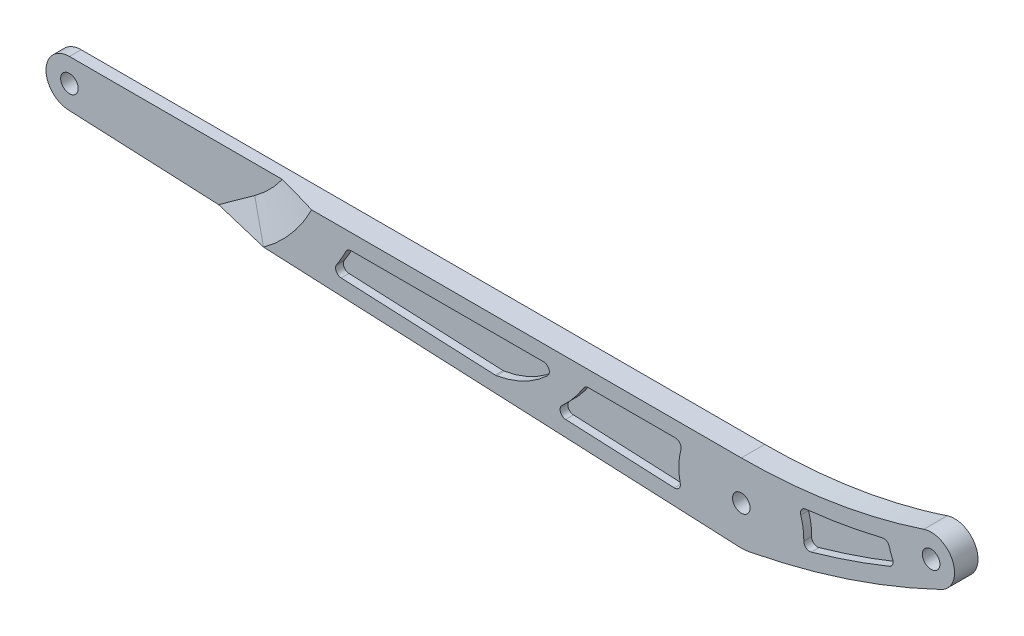
from build123d import *

# Parameters (mm, degrees)
BOSS_EXTRUDE2_DEPTH     = 4
CUT_EXTRUDE1_DEPTH      = 3
BOSS_EXTRUDE4_DEPTH     = 24
CUT_EXTRUDE3_DEPTH      = 25
CUT_EXTRUDE3_DEPTH_BACK = 183.067360447
SKETCH8_OUTSIDE_W       = 285.221
SKETCH8_OUTSIDE_H       = 85.963
CUT_EXTRUDE5_START      = -2
SKETCH15_R              = 6
CUT_EXTRUDE5_DEPTH      = 2
FILLET2_START           = -5
FILLET2_DEPTH           = 3
CUT_EXTRUDE4_DEPTH      = 2
FILLET1_R               = 1.5
FILLET1_OF_MIRROR2_R    = 1.5
CHAMFER2_SIZE           = 2
M4_CLEARANCE_HOLE1_D    = 4.5


with BuildPart() as part:
    # Sketch1 → Boss-Extrude2 (new, symmetric)
    with BuildSketch(Plane.XY):
        with BuildLine():
            Line((-174.954279742, 10), (0, 10))
            ThreePointArc((0, 10), (23.648322027, 11.894462409), (46.69345503, 17.529528282))
            ThreePointArc((46.69345503, 17.529528282), (54.142205969, 14.082195987), (51.181218931, 6.427096624))
            ThreePointArc((51.181218931, 6.427096624), (27.055536633, -3.305079876), (1.870729257, -9.823460289))
            ThreePointArc((1.870729257, -9.823460289), (0.711714534, -9.974640967), (-0.457023425, -9.98955102))
            Line((-0.457023425, -9.98955102), (-175.228493797, -1.993730612))
            ThreePointArc((-175.228493797, -1.993730612), (-180.95271219, 4.137142857), (-174.954279742, 10))
        make_face()
    extrude(amount=BOSS_EXTRUDE2_DEPTH, both=True)

    # Sketch4 → Cut-Extrude1 (cut)
    with BuildSketch(Plane.XY.offset(4)):
        with BuildLine():
            ThreePointArc((-174.954279742, 10), (-180.95271219, 4.137142857), (-175.228493797, -1.993730612))
            Line((-175.228493797, -1.993730612), (-122.27878396, -4.416187605))
            ThreePointArc((-122.27878396, -4.416187605), (-115.249733713, 2.05087413), (-109.954279742, 10))
            Line((-109.954279742, 10), (-174.954279742, 10))
        make_face()
    extrude(amount=-CUT_EXTRUDE1_DEPTH, mode=Mode.SUBTRACT)

    # Sweep2: sweep along a curve in space
    with BuildLine() as sweep2_path:
        ThreePointArc((-122.27878396, -4.416187605, 1), (-115.249733713, 2.05087413, 1), (-109.954279742, 10, 1))
    # Sketch9 → Sweep2 (sweep)
    with BuildSketch(Plane(origin=(-18.347220561, -36.300543819, 0), x_dir=(0.8924819376724606, -0.45108313083999296, 0), z_dir=(0.4510831308399929, 0.8924819376724605, 0))):
        Polygon((-102.643039948, -1), (-102.643039948, -4), (-111.643039948, -1), align=None)
    sweep(path=sweep2_path.line)

    # Sketch10 → Boss-Extrude4 (add)
    with BuildSketch(Plane(origin=(-82.616299838, -59.493723404, 0), x_dir=(0, 0, 1), z_dir=(-0.8114878209620178, -0.584369332212357, 0))):
        Polygon((1, 67.87228887), (4, 67.87228887), (1, 76.87228887), align=None)
    extrude(amount=BOSS_EXTRUDE4_DEPTH)

    # Sketch8 outside → Cut-Extrude3 (cut, two sides: drawn at the far end of the back side and taken through both)
    with BuildSketch(Plane.XY.offset(-4).offset(-CUT_EXTRUDE3_DEPTH_BACK)):
        with Locations((-63.1875, -0.3035)):
            Rectangle(SKETCH8_OUTSIDE_W, SKETCH8_OUTSIDE_H)
        with BuildLine():
            Line((0, 10), (-174.954279742, 10))
            ThreePointArc((-174.954279742, 10), (-180.95271219, 4.137142857), (-175.228493797, -1.993730612))
            Line((-175.228493797, -1.993730612), (-0.457023425, -9.98955102))
            ThreePointArc((-0.457023425, -9.98955102), (0.711714534, -9.974640967), (1.870729257, -9.823460289))
            ThreePointArc((1.870729257, -9.823460289), (27.055536633, -3.305079876), (51.181218931, 6.427096624))
            ThreePointArc((51.181218931, 6.427096624), (54.142205969, 14.082195987), (46.69345503, 17.529528282))
            ThreePointArc((46.69345503, 17.529528282), (23.648322027, 11.894462409), (0, 10))
        make_face(mode=Mode.SUBTRACT)
    extrude(amount=CUT_EXTRUDE3_DEPTH + CUT_EXTRUDE3_DEPTH_BACK, mode=Mode.SUBTRACT)

    # Sketch15 → Cut-Extrude5 (cut)
    with BuildSketch(Plane(origin=(0, 0, -4), x_dir=(-1, 0, 0), z_dir=(0, 0, -1)).offset(CUT_EXTRUDE5_START)):
        with Locations((-48.579466687, 11.83365609)):
            Circle(SKETCH15_R)
    extrude(amount=CUT_EXTRUDE5_DEPTH, mode=Mode.SUBTRACT)

    # Fillet2: read off the stored shape, not the designer's step
    # Fillet2 outline → Fillet2 (cut)
    with BuildSketch(Plane.XY.offset(FILLET2_START)):
        with BuildLine():
            ThreePointArc((40.241823664, 15.554681857), (42.163553049, 15.077161786), (42.732589809, 13.180515689))
            ThreePointArc((42.732589809, 13.180515689), (44.143492284, 15.873721819), (46.69345503, 17.529528282))
            ThreePointArc((46.69345503, 17.529528282), (43.478853193, 16.505470524), (40.241823664, 15.554681857))
        make_face()
        with BuildLine():
            ThreePointArc((45.110606605, 6.938044817), (45.943997016, 5.103233461), (44.757331788, 3.474461553))
            ThreePointArc((44.757331788, 3.474461553), (47.982323267, 4.922391468), (51.181218931, 6.427096624))
            ThreePointArc((51.181218931, 6.427096624), (48.076241077, 5.854796334), (45.110606605, 6.938044817))
        make_face()
    extrude(amount=FILLET2_DEPTH, mode=Mode.SUBTRACT)

    # Sketch14 → Cut-Extrude4 (cut)
    with BuildSketch(Plane.XY.offset(4)):
        with BuildLine():
            Line((-14.832396974, 6), (-39.944961285, 6))
            ThreePointArc((-39.944961285, 6), (-43.908510482, 0.633863605), (-48.921261535, -3.768121054))
            Line((-48.921261535, -3.768121054), (-15.091112688, -5.315855326))
            ThreePointArc((-15.091112688, -5.315855326), (-15.995819862, 0.365714286), (-14.832396974, 6))
        make_face()
        with BuildLine():
            ThreePointArc((-62.816908131, -3.132393183), (-54.164987884, -0.012926968), (-47.205713301, 6))
            Line((-47.205713301, 6), (-100.774922993, 6))
            ThreePointArc((-100.774922993, 6), (-102.783982304, 2.310087116), (-105.095731275, -1.198130822))
            Line((-105.095731275, -1.198130822), (-62.816908131, -3.132393183))
        make_face()
        with BuildLine():
            ThreePointArc((37.636421144, 10.71573201), (26.161853464, 8.260130678), (14.532481339, 6.693802069))
            ThreePointArc((14.532481339, 6.693802069), (15.849901808, 2.186461221), (15.802019276, -2.509220357))
            ThreePointArc((15.802019276, -2.509220357), (27.792022964, 1.161065661), (39.522801968, 5.590513918))
            ThreePointArc((39.522801968, 5.590513918), (38.25647934, 8.034191359), (37.636421144, 10.71573201))
        make_face()
    cut_extrude4 = extrude(amount=-CUT_EXTRUDE4_DEPTH, mode=Mode.SUBTRACT)

    # Fillet1
    fillet1_edges = [part.edges().sort_by_distance(p)[0] for p in [
        (14.532481339, 6.693802069, 3),
        (37.636421144, 10.71573201, 3),
        (39.522801968, 5.590513918, 3),
        (15.802019276, -2.509220357, 3),
        (-39.944961285, 6, 3),
        (-14.832396974, 6, 3),
        (-15.091112688, -5.315855326, 3),
        (-48.921261535, -3.768121054, 3),
        (-47.205713301, 6, 3),
        (-62.816908131, -3.132393183, 3),
        (-105.095731275, -1.198130822, 3),
        (-100.774922993, 6, 3),
    ]]
    fillet(fillet1_edges, radius=FILLET1_R)

    # Mirror2: Cut-Extrude4 across plane
    add(cut_extrude4.mirror(Plane.XY), mode=Mode.SUBTRACT)

    # Fillet1 of Mirror2
    fillet1_of_mirror2_edges = [part.edges().sort_by_distance(p)[0] for p in [
        (14.532481339, 6.693802069, -3),
        (37.636421144, 10.71573201, -3),
        (39.522801968, 5.590513918, -3),
        (15.802019276, -2.509220357, -3),
        (-39.944961285, 6, -3),
        (-14.832396974, 6, -3),
        (-15.091112688, -5.315855326, -3),
        (-48.921261535, -3.768121054, -3),
        (-47.205713301, 6, -3),
        (-62.816908131, -3.132393183, -3),
        (-105.095731275, -1.198130822, -3),
        (-100.774922993, 6, -3),
    ]]
    fillet(fillet1_of_mirror2_edges, radius=FILLET1_OF_MIRROR2_R)

    # Chamfer2
    # the kernel refuses this chamfer: 2 mm, written as the material it takes off along each edge
    with BuildSketch(Plane(origin=(-35.543855882, 186.645745489, -4), x_dir=(0.42492369608644903, -0.9052291712623004, 0), z_dir=(0.9052291712623004, 0.42492369608644903, 0))) as chamfer2_piece_1:
        Polygon((200 - CHAMFER2_SIZE, 0), (200, -CHAMFER2_SIZE), (200, 0), align=None)
    revolve(axis=Axis((-35.543855882, 186.645745489, -4), (0, 0, -1)), revolution_arc=14.36382118, mode=Mode.SUBTRACT)
    with BuildSketch(Plane(origin=(-0.457023425, -9.98955102, -4), x_dir=(0.04570234246318501, 0.9989551020408164, 0), z_dir=(-0.9989551020408164, 0.04570234246318502, 0)), Plane(origin=(-174.954279742, 10, -4), x_dir=(0, -1, 0), z_dir=(1, 0, 0))) as chamfer2_piece_2:
        Polygon((CHAMFER2_SIZE, 0), (0, -CHAMFER2_SIZE), (0, 0), align=None)
    extrude(amount=174.954279742, mode=Mode.SUBTRACT)
    with BuildSketch(Plane(origin=(0, 158.546658899, -4), x_dir=(0, -1, 0), z_dir=(-1, 0, 0))) as chamfer2_piece_3:
        Polygon((148.546658899 + CHAMFER2_SIZE, 0), (148.546658899, CHAMFER2_SIZE), (148.546658899, 0), align=None)
    revolve(axis=Axis((0, 158.546658899, -4), (0, 0, 1)), revolution_arc=17.7019097, mode=Mode.SUBTRACT)
    with BuildSketch(Plane(origin=(-174.954279742, 4, -4), x_dir=(-0.045702342463191735, -0.998955102040816, 0), z_dir=(0.998955102040816, -0.045702342463191735, 0))) as chamfer2_piece_4:
        Polygon((6 - CHAMFER2_SIZE, 0), (6, -CHAMFER2_SIZE), (6, 0), align=None)
    revolve(axis=Axis((-174.954279742, 4, -4), (0, 0, -1)), revolution_arc=177.380536242, mode=Mode.SUBTRACT)
    with BuildSketch(Plane(origin=(0, 0, -4), x_dir=(0.187072925695108, -0.9823460288879232, 0), z_dir=(0.9823460288879232, 0.187072925695108, 0))) as chamfer2_piece_5:
        Polygon((10 - CHAMFER2_SIZE, 0), (10, -CHAMFER2_SIZE), (10, 0), align=None)
    revolve(axis=Axis((0, 0, -4), (0, 0, -1)), revolution_arc=13.401476298, mode=Mode.SUBTRACT)

    # M4 Clearance Hole1 (through all)
    with Locations(Plane.XY.offset(4)):
        with Locations((0, 0), (48.579466687, 11.83365609), (-174.954279742, 4)):
            Hole(M4_CLEARANCE_HOLE1_D / 2)


solid = part.part
